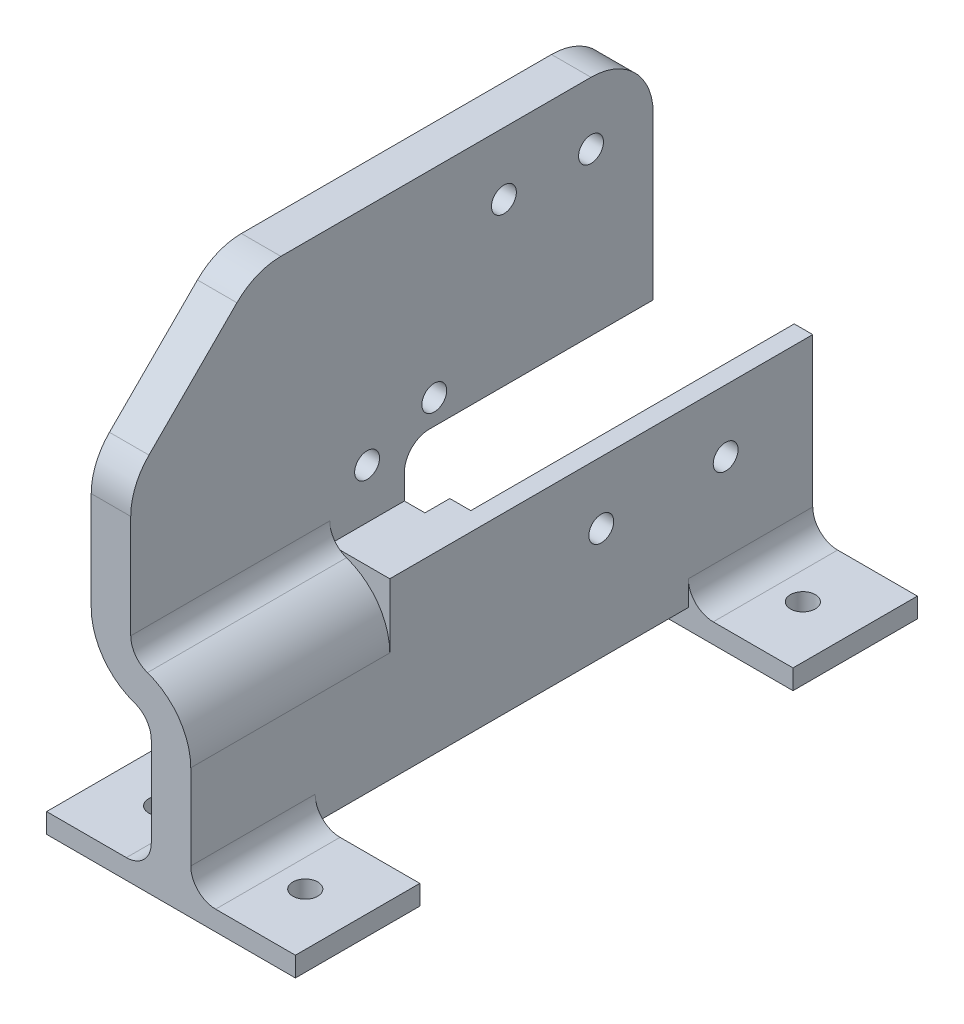
from build123d import *

# Parameters (mm, degrees)
BOSS_EXTRUDE1_DEPTH     = 250
BOSS_EXTRUDE2_DEPTH     = 50
SKETCH3_R               = 5
CUT_EXTRUDE1_DEPTH      = 319.801276513
FILLET1_R               = 10
MIRROR2_COPY_1_SKETCH_R = 5
MIRROR2_COPY_1_DEPTH    = 319.801276513
FILLET1_OF_MIRROR2_R    = 10
CUT_EXTRUDE2_DEPTH      = 282.035202699
FILLET2_R               = 25
CUT_EXTRUDE3_DEPTH      = 282.035202699
FILLET3_R               = 25
SKETCH6_R               = 5
CUT_EXTRUDE4_DEPTH      = 280.207367213
CUT_EXTRUDE5_DEPTH      = 170
FILLET4_R               = 10
FILLET5_R               = 25.875
FILLET6_R               = 10
BOSS_EXTRUDE3_DEPTH     = 30
SKETCH9_W               = 15.875
SKETCH9_H               = 40
BOSS_EXTRUDE4_DEPTH     = 140
FILLET7_R               = 25.875
FILLET8_R               = 10
SKETCH10_W              = 8.436021397
SKETCH10_H              = 40
CUT_EXTRUDE6_DEPTH      = 130
SKETCH11_R              = 5
CUT_EXTRUDE7_DEPTH      = 280.207367213


with BuildPart() as part:
    # Sketch1 → Boss-Extrude1 (new body)
    with BuildSketch(Plane.XY):
        Polygon((0, 0), (0, 110), (15.875, 110), (15.875, 0), (40, 0), (40, -70), (24.125, -70), (24.125, -15.875), (0, -15.875), align=None)
    extrude(amount=BOSS_EXTRUDE1_DEPTH)

    # Sketch2 → Boss-Extrude2 (add)
    with BuildSketch(Plane(origin=(0, 0, 0), x_dir=(-1, 0, 0), z_dir=(0, 0, -1))):
        Polygon((-32.0625, -70), (-82.0625, -70), (-82.0625, -77.9375), (17.9375, -77.9375), (17.9375, -70), align=None)
    boss_extrude2 = extrude(amount=-BOSS_EXTRUDE2_DEPTH)

    # Sketch3 → Cut-Extrude1 (cut, through all)
    with BuildSketch(Plane(origin=(0, -70, 0), x_dir=(1, 0, 0), z_dir=(0, 1, 0))):
        with Locations(Location((61.03125, -25, 0), (0, 0, 180))):
            Circle(SKETCH3_R)
    cut_extrude1 = extrude(amount=-CUT_EXTRUDE1_DEPTH, mode=Mode.SUBTRACT)

    # Mirror1: Cut-Extrude1 across plane
    add(cut_extrude1.mirror(Plane(origin=(32.0625, 0, 0), x_dir=(0, 0, 1), z_dir=(1, 0, 0))), mode=Mode.SUBTRACT)

    # Fillet1
    fillet1_edges = [part.edges().sort_by_distance(p)[0] for p in [
        (40, -70, 25),
        (24.125, -70, 25),
    ]]
    fillet(fillet1_edges, radius=FILLET1_R)

    # Mirror2: Boss-Extrude2, Cut-Extrude1 across plane
    add(boss_extrude2.mirror(Plane(origin=(0, 0, 125), x_dir=(1, 0, 0), z_dir=(0, 0, -1))))
    add(cut_extrude1.mirror(Plane(origin=(0, 0, 125), x_dir=(1, 0, 0), z_dir=(0, 0, -1))), mode=Mode.SUBTRACT)

    # Mirror2 copy 1 sketch → Mirror2 copy 1 (cut, through all)
    with BuildSketch(Plane(origin=(64.125, -70, 250), x_dir=(-1, 0, 0), z_dir=(0, 1, 0))):
        with Locations(Location((61.03125, -25, 0), (0, 0, 180))):
            Circle(MIRROR2_COPY_1_SKETCH_R)
    extrude(amount=-MIRROR2_COPY_1_DEPTH, mode=Mode.SUBTRACT)

    # Fillet1 of Mirror2
    fillet1_of_mirror2_edges = [part.edges().sort_by_distance(p)[0] for p in [
        (40, -70, 225),
        (24.125, -70, 225),
    ]]
    fillet(fillet1_of_mirror2_edges, radius=FILLET1_OF_MIRROR2_R)

    # Sketch4 → Cut-Extrude2 (cut, through all)
    with BuildSketch(Plane(origin=(15.875, 0, 0), x_dir=(0, 0, -1), z_dir=(1, 0, 0))):
        Polygon((0, 0), (-140, 0), (-140, 20), (-40, 20), (-40, 110), (0, 110), align=None)
    extrude(amount=-CUT_EXTRUDE2_DEPTH, mode=Mode.SUBTRACT)

    # Fillet2
    fillet2_edges = [part.edges().sort_by_distance(p)[0] for p in [
        (7.9375, 110, 40),
    ]]
    fillet(fillet2_edges, radius=FILLET2_R)

    # Sketch5 → Cut-Extrude3 (cut, through all)
    with BuildSketch(Plane(origin=(15.875, 0, 0), x_dir=(0, 0, -1), z_dir=(1, 0, 0))):
        Polygon((-250, 60), (-250, 110), (-200, 110), align=None)
    extrude(amount=-CUT_EXTRUDE3_DEPTH, mode=Mode.SUBTRACT)

    # Fillet3
    fillet3_edges = [part.edges().sort_by_distance(p)[0] for p in [
        (7.9375, 60, 250),
        (7.9375, 110, 200),
    ]]
    fillet(fillet3_edges, radius=FILLET3_R)

    # Sketch6 → Cut-Extrude4 (cut, through all)
    with BuildSketch(Plane(origin=(40, 0, 0), x_dir=(0, 0, -1), z_dir=(1, 0, 0))):
        with Locations((-65, 85)):
            Circle(SKETCH6_R)
        with Locations((-100, 85)):
            Circle(SKETCH6_R)
        with Locations((-128, 30)):
            Circle(SKETCH6_R)
        with Locations((-155, 20)):
            Circle(SKETCH6_R)
        with Locations(Location((-35, -25, 0), (0, 0, 90))):
            Circle(SKETCH6_R)
        with Locations(Location((-85, -25, 0), (0, 0, 90))):
            Circle(SKETCH6_R)
    extrude(amount=-CUT_EXTRUDE4_DEPTH, mode=Mode.SUBTRACT)

    # Sketch7 → Cut-Extrude5 (cut)
    with BuildSketch(Plane(origin=(0, 0, 0), x_dir=(-1, 0, 0), z_dir=(0, 0, -1))):
        Polygon((0, 0), (-40, 0), (-40, -40), (-24.125, -40), (-24.125, -15.875), (0, -15.875), align=None)
    extrude(amount=-CUT_EXTRUDE5_DEPTH, mode=Mode.SUBTRACT)

    # Fillet4
    fillet4_edges = [part.edges().sort_by_distance(p)[0] for p in [
        (7.9375, 20, 140),
    ]]
    fillet(fillet4_edges, radius=FILLET4_R)

    # Fillet5
    # the kernel refuses this fillet: 25.875 mm, written as the material it takes off along each edge
    with BuildSketch(Plane(origin=(40, 0, 105.460616433), x_dir=(-1, 0, 0), z_dir=(0, 0, 1))) as fillet5_piece_1:
        with BuildLine():
            CenterArc((25.875, 25.815753427), FILLET5_R, 180, 86.121962796)
            Line((0, 25.815753427), (-0.5175, 25.815753427))
            Line((-0.5175, 25.815753427), (-0.5175, 0))
            Line((-0.5175, 0), (0, -0.5175))
            ThreePointArc((0, -0.5175), (12.0625, -0.5175), (24.09, -0.516315069))
            Line((24.09, -0.516315069), (24.125, 0))
        make_face()
    extrude(amount=209.078767135, mode=Mode.SUBTRACT)

    # Fillet6
    fillet6_edges = [part.edges().sort_by_distance(p)[0] for p in [
        (15.875, 0, 210),
    ]]
    fillet(fillet6_edges, radius=FILLET6_R)

    # Sketch8 → Boss-Extrude3 (add)
    with BuildSketch(Plane(origin=(0, 0, 170), x_dir=(-1, 0, 0), z_dir=(0, 0, -1))):
        Polygon((-40, -40), (-24.125, -40), (-24.125, -15.875), (0, -15.875), (0, 0), (-40, 0), align=None)
    extrude(amount=BOSS_EXTRUDE3_DEPTH)

    # Sketch9 → Boss-Extrude4 (add)
    with BuildSketch(Plane(origin=(0, 0, 140), x_dir=(-1, 0, 0), z_dir=(0, 0, -1))):
        with Locations((-32.0625, -20)):
            Rectangle(SKETCH9_W, SKETCH9_H)
    extrude(amount=BOSS_EXTRUDE4_DEPTH)

    # Fillet7
    # the kernel refuses this fillet: 25.875 mm, written as the material it takes off along each edge
    with BuildSketch(Plane(origin=(0, -15.875, 75.460616433), x_dir=(1, 0, 0), z_dir=(0, 0, 1))) as fillet7_piece_1:
        with BuildLine():
            CenterArc((25.875, 25.815753427), FILLET7_R, 180, 86.121962796)
            Line((0, 25.815753427), (-0.5175, 25.815753427))
            Line((-0.5175, 25.815753427), (-0.5175, 0))
            Line((-0.5175, 0), (0, -0.5175))
            ThreePointArc((0, -0.5175), (12.0625, -0.5175), (24.09, -0.516315069))
            Line((24.09, -0.516315069), (24.125, 0))
        make_face()
    extrude(amount=239.078767135, mode=Mode.SUBTRACT)

    # Fillet8
    # the kernel refuses this fillet: 10 mm, written as the material it adds along each edge
    with BuildSketch(Plane(origin=(24.125, -15.875, 140), x_dir=(0, -1, 0), z_dir=(0, 0, 1))) as fillet8_piece_1:
        with BuildLine():
            CenterArc((8.080457645, -10), FILLET8_R, 90, 70.881309601)
            ThreePointArc((-1.36796356, -6.724738676), (-0.46005439, -3.407921221), (0, 0))
            Line((0, 0), (8.080457645, 0))
        make_face()
    extrude(amount=110)

    # Sketch10 → Cut-Extrude6 (cut)
    with BuildSketch(Plane(origin=(0, 0, 0), x_dir=(-1, 0, 0), z_dir=(0, 0, -1))):
        with Locations((-28.343010699, -20)):
            Rectangle(SKETCH10_W, SKETCH10_H)
    extrude(amount=-CUT_EXTRUDE6_DEPTH, mode=Mode.SUBTRACT)

    # Sketch11 → Cut-Extrude7 (cut, through all)
    with BuildSketch(Plane(origin=(40, 0, 0), x_dir=(0, 0, -1), z_dir=(1, 0, 0))):
        with Locations(Location((-35, -25, 0), (0, 0, 90))):
            Circle(SKETCH11_R)
        with Locations(Location((-85, -25, 0), (0, 0, 90))):
            Circle(SKETCH11_R)
    extrude(amount=-CUT_EXTRUDE7_DEPTH, mode=Mode.SUBTRACT)


solid = part.part
